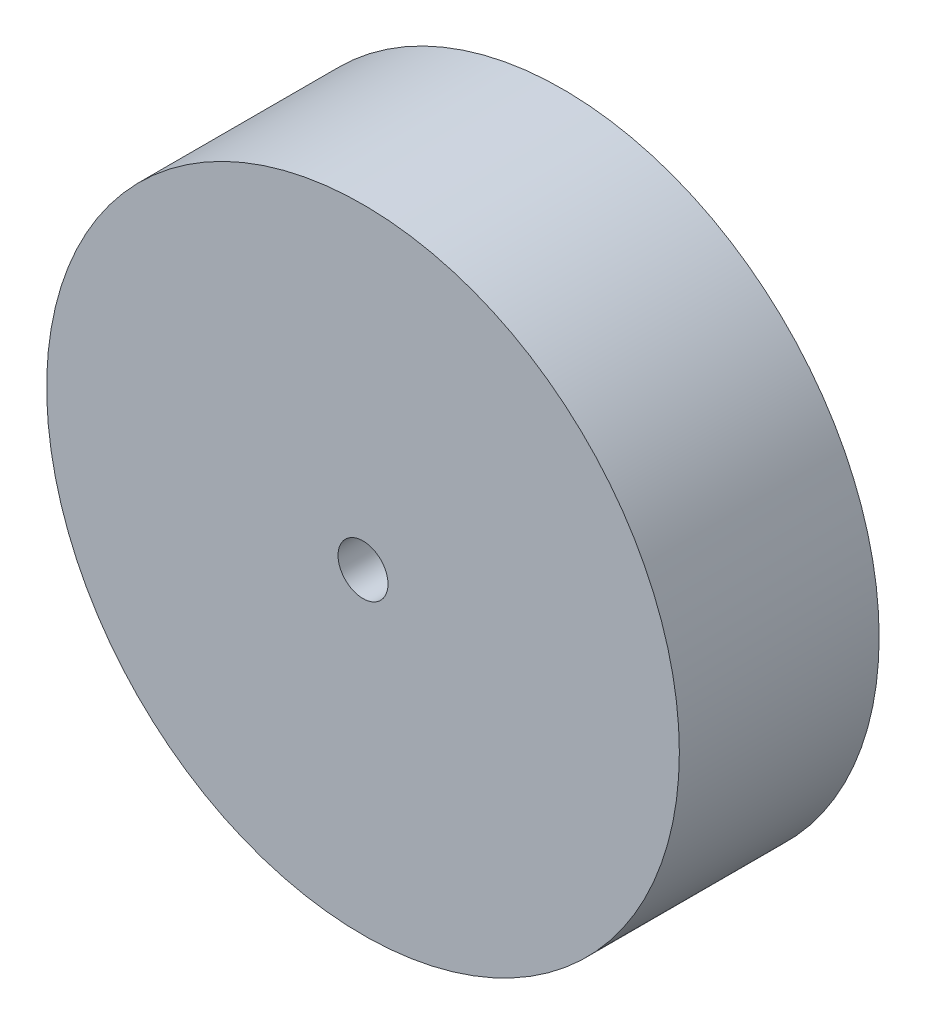
from build123d import *

# Parameters (mm, degrees)
SKETCH_1_R      = 38
SKETCH_1_R_2    = 3
EXTRUDE_1_DEPTH = 24


with BuildPart() as part:
    # 草图1 → 凸台-拉伸1 (new body)
    with BuildSketch(Plane.XY):
        Circle(SKETCH_1_R)
        Circle(SKETCH_1_R_2, mode=Mode.SUBTRACT)
    extrude(amount=EXTRUDE_1_DEPTH)


solid = part.part
